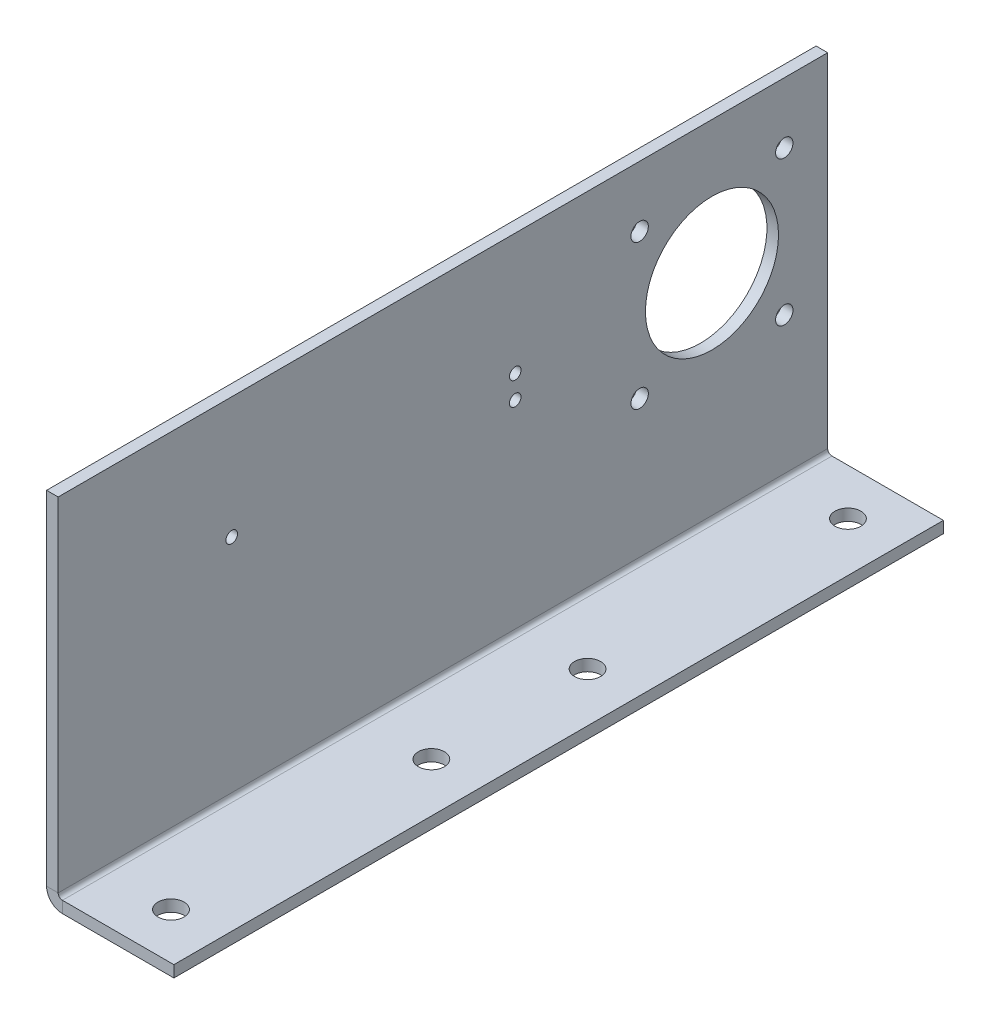
from build123d import *

# Parameters (mm, degrees)
SM_BASE_FLANGE_1_DEPTH = 133
CUT_EXTRUDE_1_REACH    = 149.557
SKETCH_2_R             = 1
SKETCH_2_R_2           = 11.5
M3X0_5_1_D             = 2.5
M3X0_5_1_DEPTH         = 7.5
M3X0_5_1_CBORE_D       = 3
M3X0_5_1_CBORE_DEPTH   = 6
M3X0_5_1_TIP           = 0.751075774
SKETCH_5_R             = 2.25
CUT_EXTRUDE_2_DEPTH    = 148.271857461


# Sheet-metal steps are written as plain solids
with BuildPart() as part:
    # Sketch 1 → 基材-凸緣1 (new body)
    with BuildSketch(Plane.XY):
        with BuildLine():
            Line((0, 60), (0, 0.7366))
            ThreePointArc((0, 0.7366), (0.215745145, 0.215745145), (0.7366, 0))
            Line((0.7366, 0), (20, 0))
            Line((20, 0), (20, -2))
            Line((20, -2), (0.7366, -2))
            ThreePointArc((0.7366, -2), (-1.198468417, -1.198468417), (-2, 0.7366))
            Line((-2, 0.7366), (-2, 60))
            Line((-2, 60), (0, 60))
        make_face()
    extrude(amount=SM_BASE_FLANGE_1_DEPTH)

    # Sketch 2 → 除料-伸長1 (cut, up to next)
    with BuildSketch(Plane.ZY.offset(2), mode=Mode.PRIVATE) as cut_extrude_1_sk1:
        with Locations((103, 39)):
            Circle(SKETCH_2_R)
    cut_extrude_1_tool1 = extrude(cut_extrude_1_sk1.sketch, amount=-CUT_EXTRUDE_1_REACH, mode=Mode.PRIVATE) & part.part
    # Sketch 2 → 除料-伸長1 (cut, up to next)
    with BuildSketch(Plane.ZY.offset(2), mode=Mode.PRIVATE) as cut_extrude_1_sk2:
        with Locations((54, 39)):
            Circle(SKETCH_2_R)
    cut_extrude_1_tool2 = extrude(cut_extrude_1_sk2.sketch, amount=-CUT_EXTRUDE_1_REACH, mode=Mode.PRIVATE) & part.part
    # Sketch 2 → 除料-伸長1 (cut, up to next)
    with BuildSketch(Plane.ZY.offset(2), mode=Mode.PRIVATE) as cut_extrude_1_sk3:
        with Locations((54, 35)):
            Circle(SKETCH_2_R)
    cut_extrude_1_tool3 = extrude(cut_extrude_1_sk3.sketch, amount=-CUT_EXTRUDE_1_REACH, mode=Mode.PRIVATE) & part.part
    # Sketch 2 → 除料-伸長1 (cut, up to next)
    with BuildSketch(Plane.ZY.offset(2), mode=Mode.PRIVATE) as cut_extrude_1_sk4:
        with Locations((20, 37)):
            Circle(SKETCH_2_R_2)
    cut_extrude_1_tool4 = extrude(cut_extrude_1_sk4.sketch, amount=-CUT_EXTRUDE_1_REACH, mode=Mode.PRIVATE) & part.part
    add(cut_extrude_1_tool1.solids().sort_by_distance((-2, 39, 103))[0], mode=Mode.SUBTRACT)
    add(cut_extrude_1_tool2.solids().sort_by_distance((-2, 39, 54))[0], mode=Mode.SUBTRACT)
    add(cut_extrude_1_tool3.solids().sort_by_distance((-2, 35, 54))[0], mode=Mode.SUBTRACT)
    add(cut_extrude_1_tool4.solids().sort_by_distance((-2, 37, 20))[0], mode=Mode.SUBTRACT)

    # M3x0.5 螺紋孔1
    with Locations(Plane.ZY.offset(2)):
        with Locations((32.5, 49.5), (32.5, 24.5), (7.5, 49.5), (7.5, 24.5)):
            CounterBoreHole(M3X0_5_1_D / 2, M3X0_5_1_CBORE_D / 2, M3X0_5_1_CBORE_DEPTH, depth=M3X0_5_1_DEPTH)
            with Locations((0, 0, -(M3X0_5_1_DEPTH + M3X0_5_1_TIP / 2))):  # 118° drill point
                Cone(0, M3X0_5_1_D / 2, M3X0_5_1_TIP, mode=Mode.SUBTRACT)

    # 草圖5 → 除料-伸長2 (cut, through all)
    with BuildSketch(Plane(origin=(0, 0, 0), x_dir=(1, 0, 0), z_dir=(0, 1, 0))):
        with Locations(Location((11.5, -125, 0), (0, 0, 270))):
            Circle(SKETCH_5_R)
        with Locations(Location((11.5, -80, 0), (0, 0, 270))):
            Circle(SKETCH_5_R)
        with Locations(Location((11.5, -53, 0), (0, 0, 270))):
            Circle(SKETCH_5_R)
        with Locations(Location((11.5, -8, 0), (0, 0, 270))):
            Circle(SKETCH_5_R)
    extrude(amount=-CUT_EXTRUDE_2_DEPTH, mode=Mode.SUBTRACT)


solid = part.part
